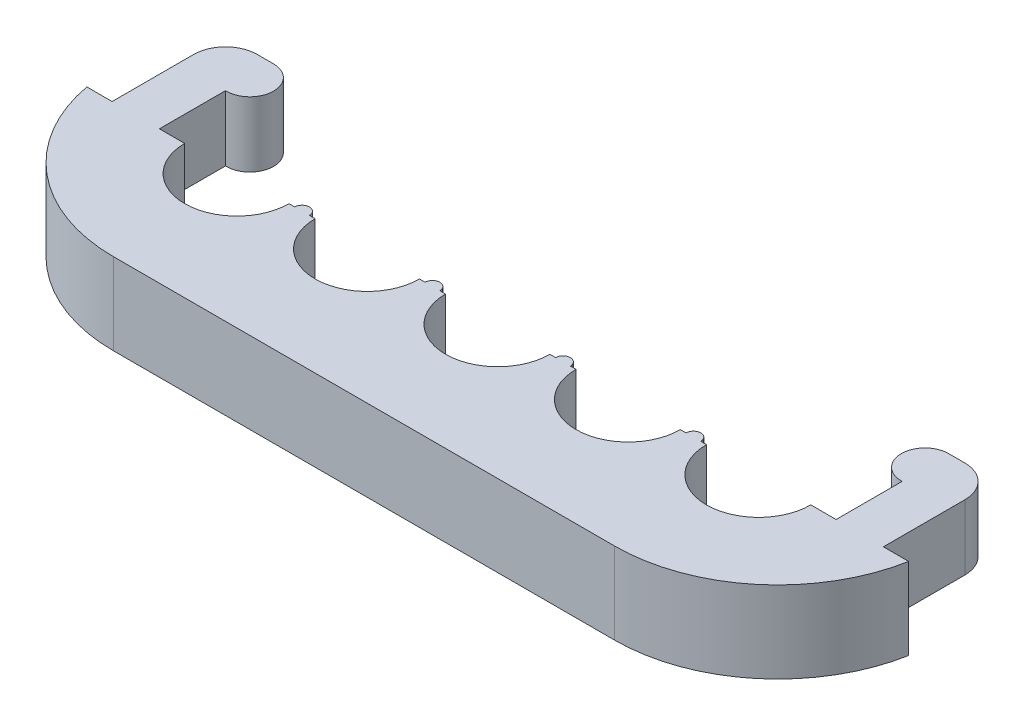
from build123d import *

# Parameters (mm, degrees)
RESSALTO_EXTRUS_O1_DEPTH = 2.5
RESSALTO_EXTRUS_O2_DEPTH = 4
FILETE1_R                = 10
ESBO_O2_R                = 0.45
RESSALTO_EXTRUS_O3_DEPTH = 5


with BuildPart() as part:
    # Esboço1 → Ressalto-extrusão1 (new, symmetric)
    with BuildSketch(Plane(origin=(0, 0, 0), x_dir=(1, 0, 0), z_dir=(0, 1, 0))):
        with BuildLine():
            Line((-25.2, 0), (-19.2, 0))
            ThreePointArc((-19.2, 0), (-16, -3.2), (-12.8, 0))
            Line((-12.8, 0), (-11.2, 0))
            ThreePointArc((-11.2, 0), (-8, -3.2), (-4.8, 0))
            Line((-4.8, 0), (-3.2, 0))
            ThreePointArc((-3.2, 0), (0, -3.2), (3.2, 0))
            Line((3.2, 0), (4.8, 0))
            ThreePointArc((4.8, 0), (8, -3.2), (11.2, 0))
            Line((11.2, 0), (12.8, 0))
            ThreePointArc((12.8, 0), (16, -3.2), (19.2, 0))
            Line((19.2, 0), (25.2, 0))
            Line((25.2, 0), (25.2, -8.2))
            Line((25.2, -8.2), (-25.2, -8.2))
            Line((-25.2, -8.2), (-25.2, 0))
        make_face()
    extrude(amount=RESSALTO_EXTRUS_O1_DEPTH, both=True)

    # Esboço3 → Ressalto-extrusão2 (add)
    with BuildSketch(Plane(origin=(0, 2.5, 0), x_dir=(1, 0, 0), z_dir=(0, 1, 0))):
        with BuildLine():
            Line((-23.65, 5), (-23.65, 0))
            Line((-23.65, 0), (-20.75, 0))
            Line((-20.75, 0), (-20.75, 4.050862325))
            ThreePointArc((-20.75, 4.050862325), (-19.250215597, 5.474996282), (-20.7, 6.95))
            Line((-20.7, 6.95), (-21.7, 6.95))
            ThreePointArc((-21.7, 6.95), (-23.078858223, 6.378858223), (-23.65, 5))
        make_face()
        with BuildLine():
            Line((23.65, 0), (20.75, 0))
            Line((20.75, 0), (20.75, 4.050862325))
            ThreePointArc((20.75, 4.050862325), (19.250215597, 5.474996282), (20.7, 6.95))
            Line((20.7, 6.95), (21.7, 6.95))
            ThreePointArc((21.7, 6.95), (23.078858223, 6.378858223), (23.65, 5))
            Line((23.65, 5), (23.65, 0))
        make_face()
    extrude(amount=-RESSALTO_EXTRUS_O2_DEPTH)

    # Filete1
    # the kernel refuses this fillet: 10 mm, written as the material it takes off along each edge
    with BuildSketch(Plane(origin=(-25.2, 27.091665255, 8.2), x_dir=(1, 0, 0), z_dir=(0, -1, 0))) as filete1_piece_1:
        with BuildLine():
            CenterArc((9.836666102, -10), FILETE1_R, 90, 79.630240195)
            Line((0, -8.2), (-0.196733322, -8.164))
            ThreePointArc((-0.196733322, -8.164), (-0.2, -4.1), (-0.2, 0))
            Line((-0.2, 0), (0, 0.2))
            Line((0, 0.2), (9.836666102, 0.2))
            Line((9.836666102, 0.2), (9.836666102, 0))
        make_face()
    extrude(amount=54.183330509, mode=Mode.SUBTRACT)
    with BuildSketch(Plane(origin=(25.2, 27.091665255, 8.2), x_dir=(0, 0, -1), z_dir=(0, -1, 0))) as filete1_piece_2:
        with BuildLine():
            CenterArc((10, -9.836666102), FILETE1_R, 100.369759805, 79.630240195)
            Line((0, -9.836666102), (-0.2, -9.836666102))
            Line((-0.2, -9.836666102), (-0.2, 0))
            Line((-0.2, 0), (0, 0.2))
            ThreePointArc((0, 0.2), (4.1, 0.2), (8.164, 0.196733322))
            Line((8.164, 0.196733322), (8.2, 0))
        make_face()
    extrude(amount=54.183330509, mode=Mode.SUBTRACT)

    # Esboço2 → Ressalto-extrusão3 (add, through all)
    with BuildSketch(Plane(origin=(0, 2.5, 0), x_dir=(1, 0, 0), z_dir=(0, 1, 0))):
        with Locations((-12, 0)):
            Circle(ESBO_O2_R)
        with Locations((-4, 0)):
            Circle(ESBO_O2_R)
        with Locations((4, 0)):
            Circle(ESBO_O2_R)
        with Locations((12, 0)):
            Circle(ESBO_O2_R)
    extrude(amount=-RESSALTO_EXTRUS_O3_DEPTH)


solid = part.part
